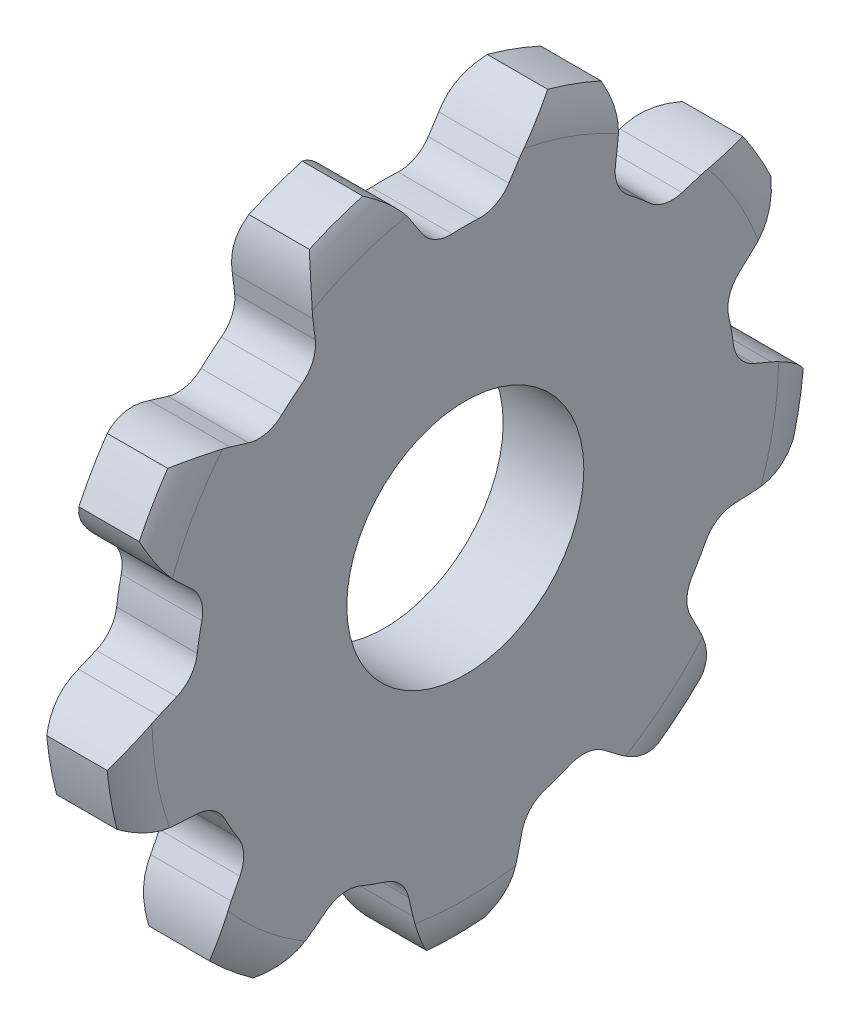
from build123d import *

# Parameters (mm, degrees)
TOOTHCUT_DEPTH  = 54.667092352
TEETHCUTS_COUNT = 9
TEETHCUTS_ANGLE = 320
BORSKE_R        = 12.7
BORE_DEPTH      = 22.3520508


with BuildPart() as part:
    # BasProSke → Base-Revolve (revolve)
    with BuildSketch(Plane(origin=(0, 0, 0), x_dir=(1, 0, 0), z_dir=(0, 1, 0))):
        with BuildLine():
            Line((0, 0), (0, 33.567613594))
            ThreePointArc((0, 33.567613594), (0.274889268, 35.58428602), (1.0795, 37.453813594))
            Line((1.0795, 37.453813594), (7.5565, 37.453813594))
            ThreePointArc((7.5565, 37.453813594), (8.361110732, 35.58428602), (8.636, 33.567613594))
            Line((8.636, 33.567613594), (8.636, 0))
            Line((8.636, 0), (0, 0))
        make_face()
    revolve(axis=Axis((-10, 0, 0), (1, 0, 0)))

    # TooCutSke → ToothCut (cut, through all)
    with BuildSketch(Plane(origin=(0, 0, 0), x_dir=(0, 0, -1), z_dir=(1, 0, 0))):
        with BuildLine():
            Line((-4.666651728, 30.571549138), (-5.792172258, 32.304698768))
            ThreePointArc((-5.792172258, 32.304698768), (-9.160912638, 35.675881581), (-13.608353507, 37.388643976))
            ThreePointArc((-13.608353507, 37.388643976), (0, 39.788163862), (13.608353507, 37.388643976))
            ThreePointArc((13.608353507, 37.388643976), (9.160912638, 35.675881581), (5.792172258, 32.304698768))
            Line((5.792172258, 32.304698768), (4.666651728, 30.571549138))
            ThreePointArc((4.666651728, 30.571549138), (3.265006939, 29.307412549), (1.419729481, 28.910423216))
            ThreePointArc((1.419729481, 28.910423216), (0, 28.945262174), (-1.419729481, 28.910423216))
            ThreePointArc((-1.419729481, 28.910423216), (-3.265006939, 29.307412549), (-4.666651728, 30.571549138))
        make_face()
    toothcut = extrude(amount=TOOTHCUT_DEPTH, mode=Mode.SUBTRACT)

    # TeethCuts: ToothCut ×9 about axis
    teethcuts_axis = Axis((-10, 0, 0), (1, 0, 0))
    for i in range(1, TEETHCUTS_COUNT):
        add(toothcut.rotate(teethcuts_axis, i * TEETHCUTS_ANGLE / (TEETHCUTS_COUNT - 1)), mode=Mode.SUBTRACT)

    # BorSke → Bore (cut, symmetric)
    with BuildSketch(Plane(origin=(0, 0, 0), x_dir=(0, 0, -1), z_dir=(1, 0, 0))):
        Circle(BORSKE_R)
    extrude(amount=BORE_DEPTH, both=True, mode=Mode.SUBTRACT)


solid = part.part
